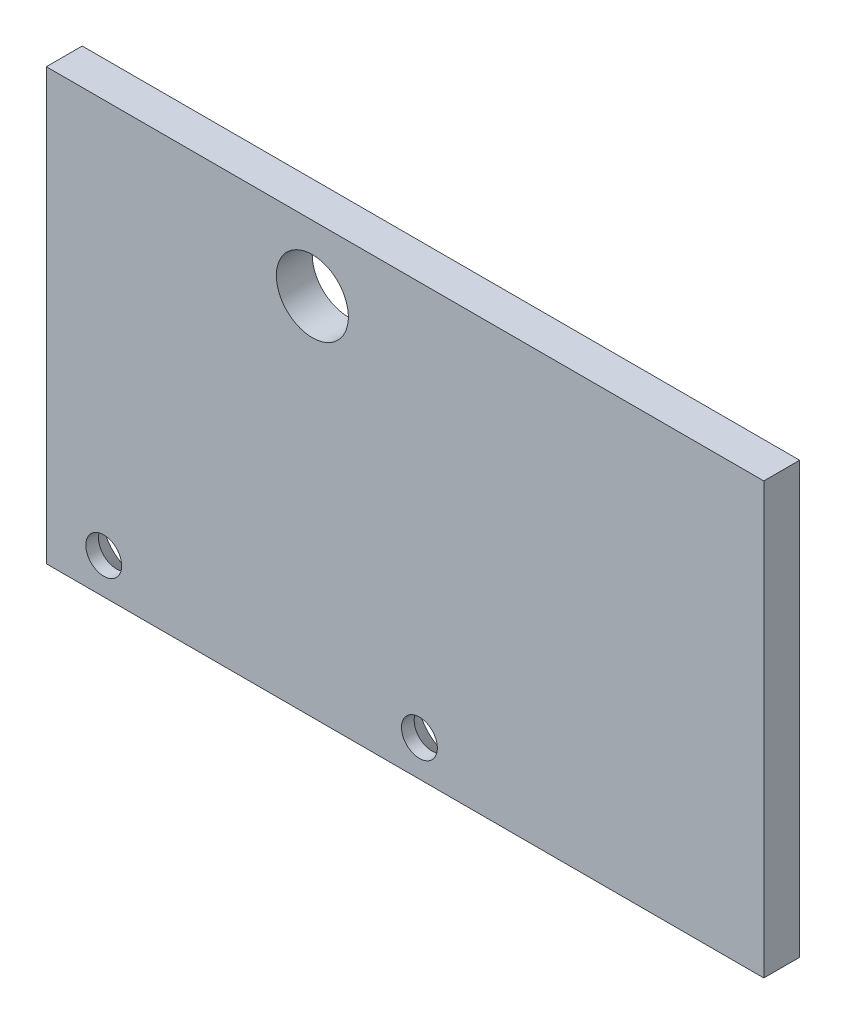
from build123d import *

# Parameters (mm, degrees)
SKETCH1_W                            = 127
SKETCH1_H                            = 76.2
BOSS_EXTRUDE1_DEPTH                  = 6.35
CUT_EXTRUDE1_DEPTH                   = 149.24224263
CUT_EXTRUDE1_DEPTH_BACK              = 149.24224263
SKETCH4_R                            = 6.3754
F_1_4_0_25_DIAMETER_HOLE1_AT_2_COUNT = 2
F_1_4_0_25_DIAMETER_HOLE1_AT_2_PITCH = 55.88


with BuildPart() as part:
    # Sketch1 → Boss-Extrude1 (new body)
    with BuildSketch(Plane.XY):
        with Locations((-63.5, 38.1)):
            Rectangle(SKETCH1_W, SKETCH1_H)
    extrude(amount=BOSS_EXTRUDE1_DEPTH)

    # Sketch4 → Cut-Extrude1 (cut, two sides: drawn at the far end of the back side and taken through both)
    with BuildSketch(Plane(origin=(0, 0, 0), x_dir=(-1, 0, 0), z_dir=(0, 0, -1)).offset(-CUT_EXTRUDE1_DEPTH_BACK)):
        with Locations((79.912500047, 64.573038165)):
            Circle(SKETCH4_R)
    extrude(amount=CUT_EXTRUDE1_DEPTH + CUT_EXTRUDE1_DEPTH_BACK, mode=Mode.SUBTRACT)

    # Sketch8 → 1/4 (0.25) Diameter Hole1 (revolve, cut)
    with BuildSketch(Plane(origin=(-116.84, 6.35, 0), x_dir=(0, 1, 0), z_dir=(1, 0, 0))):
        Polygon((0, 0), (0, 6.35), (3.175, 6.35), (3.175, 4.105319735), (6.7437, 0), align=None)
    f_1_4_0_25_diameter_hole1 = revolve(axis=Axis((-116.84, 6.35, -6.35), (0, 0, 1)), mode=Mode.SUBTRACT)

    # 1/4 (0.25) Diameter Hole1 at 2: 1/4 (0.25) Diameter Hole1 ×2
    with Locations(*[(i * F_1_4_0_25_DIAMETER_HOLE1_AT_2_PITCH, 0, 0) for i in range(1, F_1_4_0_25_DIAMETER_HOLE1_AT_2_COUNT)]):
        add(f_1_4_0_25_diameter_hole1, mode=Mode.SUBTRACT)


solid = part.part
